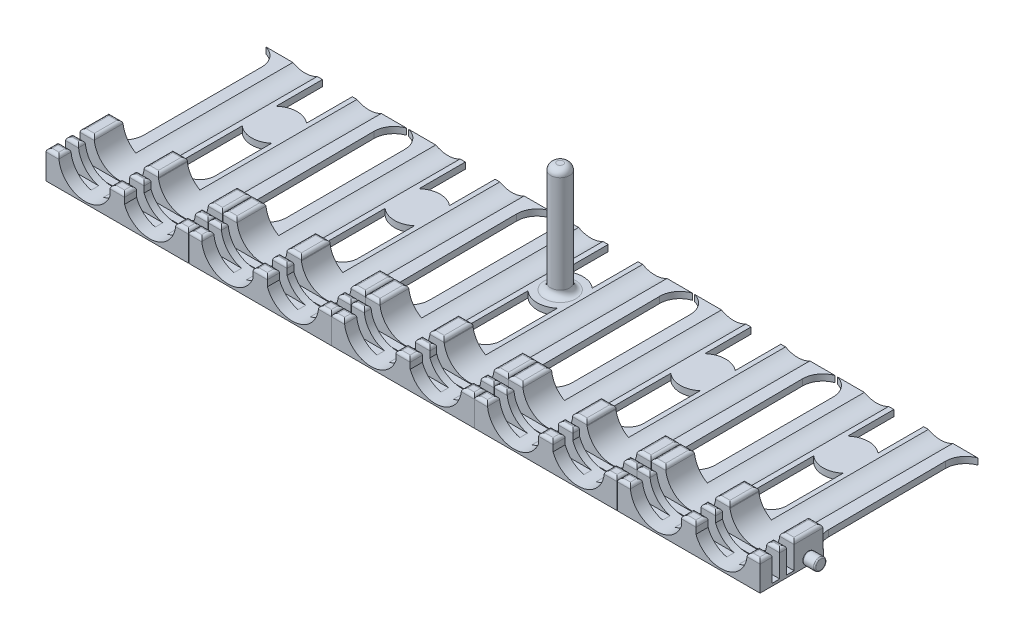
from build123d import *

# Parameters (mm, degrees)
SKETCH1_W           = 25
SKETCH1_H           = 90
BOSS_EXTRUDE1_DEPTH = 9
SKETCH4_W           = 8
SKETCH4_H           = 71
SKETCH5_W           = 25
SKETCH5_H           = 2.4
SKETCH5_W_2         = 28
FLANGE_SLOT_DEPTH   = 8.2
SKETCH6_W           = 8.432931683
SKETCH6_H           = 8.432931683
SKETCH18_W          = 25
SKETCH18_H          = 50
SYRINGE_BAY_DEPTH   = 7
SKETCH26_W          = 38.352553791
SKETCH26_H          = 20.215566654
CUT_EXTRUDE14_DEPTH = 10
LPATTERN3_COUNT     = 2
LPATTERN3_PITCH     = 20.4
SKETCH31_R          = 1.9
CUT_EXTRUDE16_DEPTH = 4
SKETCH33_R          = 1.9
BOSS_EXTRUDE2_DEPTH = 4
FILLET1_R           = 0.4
FILLET2_R           = 0.6
CUT_EXTRUDE17_DEPTH = 10
FILLET7_R           = 1
LPATTERN5_COUNT     = 3
LPATTERN5_PITCH     = 45.5
LPATTERN5_2_COUNT   = 3
LPATTERN5_2_PITCH   = 45.5
SKETCH36_R          = 3
BOSS_EXTRUDE3_DEPTH = 35
FILLET5_R           = 2


with BuildPart() as part:
    # Sketch1 → Boss-Extrude1 (new body)
    with BuildSketch(Plane(origin=(0, 0, 0), x_dir=(1, 0, 0), z_dir=(0, 1, 0))):
        Rectangle(SKETCH1_W, SKETCH1_H)
    extrude(amount=BOSS_EXTRUDE1_DEPTH)

    # Sketch4 → Syringe Body slot (revolve, cut)
    with BuildSketch(Plane(origin=(0, 9, 0), x_dir=(1, 0, 0), z_dir=(0, 1, 0))):
        with Locations((-4, 1.3)):
            Rectangle(SKETCH4_W, SKETCH4_H)
    revolve(axis=Axis((0, 9, -36.8), (0, 0, 1)), mode=Mode.SUBTRACT)

    # Sketch5 → Flange Slot (cut)
    with BuildSketch(Plane(origin=(0, 9, 0), x_dir=(1, 0, 0), z_dir=(0, 1, 0))):
        with Locations((0, -35.367068317)):
            Rectangle(SKETCH5_W, SKETCH5_H)
        with Locations((0, -39.936134865)):
            Rectangle(SKETCH5_W_2, SKETCH5_H)
    extrude(amount=-FLANGE_SLOT_DEPTH, mode=Mode.SUBTRACT)

    # Sketch6 → Plunger Slot (revolve, cut)
    with BuildSketch(Plane(origin=(0, 9, 0), x_dir=(1, 0, 0), z_dir=(0, 1, 0))):
        with Locations((-4.216465842, -40.783534159)):
            Rectangle(SKETCH6_W, SKETCH6_H)
    revolve(axis=Axis((0, 9, 45), (0, 0, -1)), mode=Mode.SUBTRACT)

    # Sketch18 → Syringe Bay (cut)
    with BuildSketch(Plane(origin=(0, 9, 0), x_dir=(1, 0, 0), z_dir=(0, 1, 0))):
        Rectangle(SKETCH18_W, SKETCH18_H)
    extrude(amount=-SYRINGE_BAY_DEPTH, mode=Mode.SUBTRACT)

    # Sketch26 → Cut-Extrude14 (cut)
    with BuildSketch(Plane(origin=(0, 9, 0), x_dir=(1, 0, 0), z_dir=(0, 1, 0))):
        with Locations((-0.72363309, 35.107783327)):
            Rectangle(SKETCH26_W, SKETCH26_H)
    extrude(amount=-CUT_EXTRUDE14_DEPTH, mode=Mode.SUBTRACT)


with BuildPart() as lpattern3_1:
    # LPattern3: pattern copy
    add(part.part.moved(Location(Vector(1, 0, 0) * (1 * LPATTERN3_PITCH))))


with BuildPart() as part_1:
    add(part.part)

    # Sketch31 → Cut-Extrude16 (cut)
    with BuildSketch(Plane.ZY.offset(12.5)):
        with Locations((29.687280392, 2.231257616)):
            Circle(SKETCH31_R)
    extrude(amount=-CUT_EXTRUDE16_DEPTH, mode=Mode.SUBTRACT)

    # Fillet2
    # the kernel refuses this fillet: 0.6 mm, written as the material it adds along each edge
    with BuildSketch(Plane(origin=(-8.5, 2.231257616, 29.687280392), x_dir=(0, 0, 1), z_dir=(0, -1, 0))) as fillet2_piece_1:
        with BuildLine():
            CenterArc((1.9 - FILLET2_R, FILLET2_R), FILLET2_R, 270, 90)
            Line((1.9 - FILLET2_R, 0), (1.9, 0))
            Line((1.9, 0), (1.9, FILLET2_R))
        make_face()
    revolve(axis=Axis((-8.5, 2.231257616, 29.687280392), (-1, 0, 0)))
    # the kernel refuses this fillet: 0.6 mm, written as the material it takes off along each edge
    with BuildSketch(Plane(origin=(-12.5, 2.231257616, 29.687280392), x_dir=(0, 0, 1), z_dir=(0, -1, 0))) as fillet2_2_piece_1:
        with BuildLine():
            CenterArc((1.9 + FILLET2_R, -FILLET2_R), FILLET2_R, 90, 90)
            Line((1.9, -FILLET2_R), (1.9, 0))
            Line((1.9, 0), (1.9 + FILLET2_R, 0))
        make_face()
    revolve(axis=Axis((-12.5, 2.231257616, 29.687280392), (-1, 0, 0)), mode=Mode.SUBTRACT)


with BuildPart() as body_3:
    # Sketch33 → Boss-Extrude2 (new body)
    with BuildSketch(Plane(origin=(32.9, 0, 0), x_dir=(0, 0, -1), z_dir=(1, 0, 0))):
        with Locations((-29.687280392, 2.231257616)):
            Circle(SKETCH33_R)
    extrude(amount=BOSS_EXTRUDE2_DEPTH)

    # Fillet1
    fillet1_edges = [body_3.edges().sort_by_distance(p)[0] for p in [
        (32.9, 2.231257616, 31.587280392),
        (36.9, 2.231257616, 31.587280392),
    ]]
    fillet(fillet1_edges, radius=FILLET1_R)


with BuildPart() as cut_extrude17_tool:
    # Sketch35 → Cut-Extrude17 (new body)
    with BuildSketch(Plane(origin=(0, 2, 0), x_dir=(1, 0, 0), z_dir=(0, 1, 0))):
        with BuildLine():
            Line((-7.572519934, 18.75), (-7.572519934, -18.75))
            ThreePointArc((-7.572519934, -18.75), (-14, -25.177480066), (-20.427480066, -18.75))
            Line((-20.427480066, -18.75), (-20.427480066, 18.75))
            ThreePointArc((-20.427480066, 18.75), (-14, 25.177480066), (-7.572519934, 18.75))
        make_face()
        with BuildLine():
            Line((15.038012539, 25.284497927), (15.038012539, 10.435091669))
            ThreePointArc((15.038012539, 10.435091669), (10.258664257, 12.127791533), (5.538012539, 10.277696889))
            Line((5.538012539, 10.277696889), (5.538012539, 25.284497927))
            ThreePointArc((5.538012539, 25.284497927), (10.288012539, 30.034497927), (15.038012539, 25.284497927))
        make_face()
        with BuildLine():
            Line((28.019587368, 18.885486869), (28.305082347, -18.61342635))
            ThreePointArc((28.305082347, -18.61342635), (34.781309827, -24.991786455), (41.159669932, -18.515558975))
            Line((41.159669932, -18.515558975), (40.874174953, 18.983354244))
            ThreePointArc((40.874174953, 18.983354244), (34.397947473, 25.361714349), (28.019587368, 18.885486869))
        make_face()
        with BuildLine():
            Line((15.038012539, -0.688026199), (15.038012539, -18.75))
            ThreePointArc((15.038012539, -18.75), (10.288012539, -23.5), (5.538012539, -18.75))
            Line((5.538012539, -18.75), (5.538012539, -0.530631419))
            ThreePointArc((5.538012539, -0.530631419), (10.258664257, -2.380726063), (15.038012539, -0.688026199))
        make_face()
    extrude(amount=-CUT_EXTRUDE17_DEPTH)


with BuildPart() as part_2:
    add(part_1.part)

    # Cut-Extrude17: cut by cut_extrude17_tool
    add(cut_extrude17_tool.part, mode=Mode.SUBTRACT)


with BuildPart() as lpattern3_1_1:
    add(lpattern3_1.part)

    # Cut-Extrude17: cut by cut_extrude17_tool
    add(cut_extrude17_tool.part, mode=Mode.SUBTRACT)

    # Combine2: union part, body 3
    add(part_2.part)
    add(body_3.part)

    # Fillet7
    fillet7_edges = [lpattern3_1_1.edges().sort_by_distance(p)[0] for p in [
        (7.9, 9, 29.583534158),
        (10.2, 9, 25),
        (30.65, 9, 25),
        (10.2, 9, 45),
        (32.9, 9, 37.651601591),
        (32.9, 9, 29.583534158),
        (7.9, 9, 37.651601591),
        (7.9, 9, 43.068067433),
        (10.2, 9, 41.136134865),
        (30.866465842, 9, 38.736134865),
        (-10.25, 9, 34.167068317),
        (12.5, 9, 37.651601591),
        (12.5, 9, 43.068067433),
        (-8.432931683, 9, 37.651601591),
        (-8.432931683, 9, 43.068067433),
        (-12.5, 9, 29.583534158),
        (-8, 9, 29.583534158),
        (12.5, 9, 29.583534158),
        (-12.5, 9, 37.651601591),
        (-12.5, 9, 43.068067433),
        (-10.466465842, 9, 45),
        (-10.466465842, 9, 38.736134865),
        (-10.466465842, 9, 36.567068317),
        (-10.466465842, 9, 41.136134865),
        (-10.25, 9, 25),
        (10.2, 9, 34.167068317),
        (10.2, 9, 36.567068317),
        (30.65, 9, 34.167068317),
        (32.9, 9, 43.068067433),
        (10.2, 9, 38.736134865),
        (30.866465842, 9, 41.136134865),
        (30.866465842, 9, 36.567068317),
        (30.866465842, 9, 45),
        (28.832931683, 9, 37.651601591),
        (28.832931683, 9, 43.068067433),
        (28.4, 9, 29.583534158),
    ]]
    fillet(fillet7_edges, radius=FILLET7_R)


with BuildPart() as lpattern5_1:
    # LPattern5: pattern copy
    add(lpattern3_1_1.part.moved(Location(Vector(-1, 0, 0) * (1 * LPATTERN5_PITCH))))


with BuildPart() as lpattern5_2:
    # LPattern5: pattern copy
    add(lpattern3_1_1.part.moved(Location(Vector(-1, 0, 0) * (2 * LPATTERN5_PITCH))))


with BuildPart() as lpattern5_2_1:
    # LPattern5 2: pattern copy
    add(lpattern3_1_1.part.moved(Location(Vector(1, 0, 0) * (1 * LPATTERN5_2_PITCH))))


with BuildPart() as lpattern5_2_2:
    # LPattern5 2: pattern copy
    add(lpattern3_1_1.part.moved(Location(Vector(1, 0, 0) * (2 * LPATTERN5_2_PITCH))))


with BuildPart() as lpattern3_1_2:
    add(lpattern3_1_1.part)

    # Sketch36 → Boss-Extrude3 (add)
    with BuildSketch(Plane(origin=(0, 2, 0), x_dir=(1, 0, 0), z_dir=(0, 1, 0))):
        with Locations(Location((10.378851885, 4.873532735, 0), (0, 0, 90))):
            Circle(SKETCH36_R)
    extrude(amount=BOSS_EXTRUDE3_DEPTH)

    # Fillet5
    fillet5_edges = [lpattern3_1_2.edges().sort_by_distance(p)[0] for p in [
        (10.378851885, 2, -1.873532735),
        (10.378851885, 37, -1.873532735),
    ]]
    fillet(fillet5_edges, radius=FILLET5_R)


with BuildPart() as lpattern5_2_1_1:
    add(lpattern5_2_1.part)

    # Combine3: union LPattern5 2_2, LPattern3_1, LPattern5_1, LPattern5_2
    add(lpattern5_2_2.part)
    add(lpattern3_1_2.part)
    add(lpattern5_1.part)
    add(lpattern5_2.part)


solid = lpattern5_2_1_1.part
